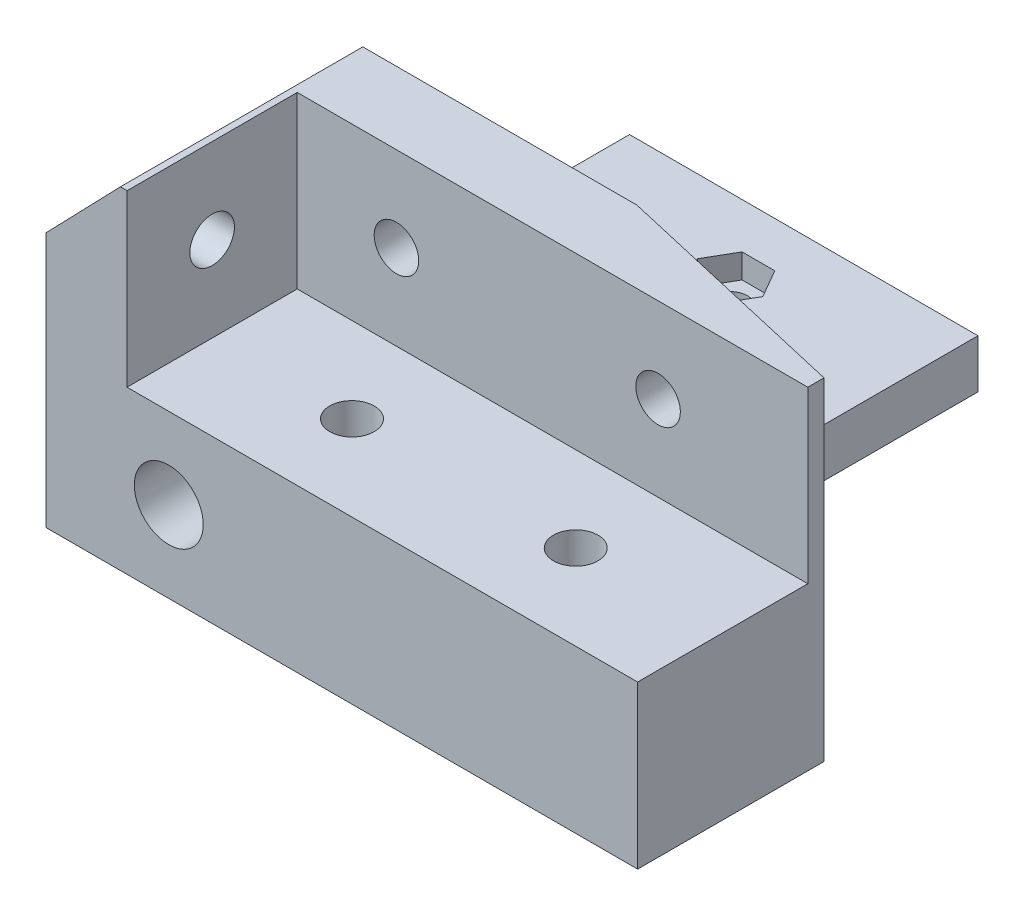
from build123d import *

# Parameters (mm, degrees)
SKETCH_1_R          = 2.15
EXTRUDE_1_DEPTH     = 6
EXTRUDE_2_DEPTH     = 35
SKETCH_3_W          = 63
SKETCH_3_H          = 21
CUT_EXTRUDE_1_DEPTH = 21
SKETCH_4_R          = 2.75
CUT_EXTRUDE_2_DEPTH = 87.609201921
CHAMFER_1_SIZE      = 9.5
CHAMFER_1_SIZE_2    = 9.174043361
CUT_EXTRUDE_START   = -10
SKETCH_5_R          = 4.25
CUT_EXTRUDE_3_DEPTH = 5
SKETCH_6_R          = 2.75
CUT_EXTRUDE_4_DEPTH = 78.360370477
CUT_EXTRUDE_START_2 = -4
SKETCH_7_R          = 4.25
CUT_EXTRUDE_5_DEPTH = 5
SKETCH_8_R          = 2.75
CUT_EXTRUDE_6_DEPTH = 64.20427816
SKETCH_10_R         = 4.25
CUT_EXTRUDE_7_DEPTH = 15.5
SKETCH_11_R         = 4.25
CUT_EXTRUDE_8_DEPTH = 20
CUT_EXTRUDE_9_DEPTH = 3


with BuildPart() as part:
    # Эскиз1 → Бобышка-Вытянуть1 (new body)
    with BuildSketch(Plane(origin=(0, 0, 0), x_dir=(1, 0, 0), z_dir=(0, 1, 0))):
        Polygon((-31.737099952, -43.025037564), (41.262900048, -43.025037564), (41.262900048, -20.025037564), (11.262900048, -13.109402144), (11.262900048, 28.974962436), (-31.737099952, 28.974962436), align=None)
        with Locations(Location((-10.237099952, 19.879797383, 0), (0, 0, 270))):
            Circle(SKETCH_1_R, mode=Mode.SUBTRACT)
        with Locations(Location((0, 0, 0), (0, 0, 270))):
            Circle(SKETCH_1_R, mode=Mode.SUBTRACT)
    extrude(amount=EXTRUDE_1_DEPTH)

    # Эскиз2 → Бобышка-Вытянуть2 (add)
    with BuildSketch(Plane(origin=(0, 6, 0), x_dir=(1, 0, 0), z_dir=(0, 1, 0))):
        Polygon((41.262900048, -20.025037564), (11.262900048, -13.109402144), (-31.737099952, -13.109402144), (-31.737099952, -43.025037564), (41.262900048, -43.025037564), align=None)
    extrude(amount=EXTRUDE_2_DEPTH)

    # Эскиз3 → Вырез-Вытянуть1 (cut)
    with BuildSketch(Plane(origin=(0, 41, 0), x_dir=(1, 0, 0), z_dir=(0, 1, 0))):
        with Locations((9.762900048, -32.525037564)):
            Rectangle(SKETCH_3_W, SKETCH_3_H)
    extrude(amount=-CUT_EXTRUDE_1_DEPTH, mode=Mode.SUBTRACT)

    # Эскиз4 → Вырез-Вытянуть2 (cut, through all)
    with BuildSketch(Plane(origin=(-21.737099952, 0, 0), x_dir=(0, 0, -1), z_dir=(1, 0, 0))):
        with Locations((-32.525037564, 30.5)):
            Circle(SKETCH_4_R)
    extrude(amount=-CUT_EXTRUDE_2_DEPTH, mode=Mode.SUBTRACT)

    # Фаска1
    # the kernel refuses this chamfer: 9.5, 9.174043361 mm, written as the material it takes off along each edge
    with BuildSketch(Plane(origin=(-31.737099952, 41, -11.332881065), x_dir=(-0.026999337430198715, -0.9996354514413394, 0), z_dir=(0, 0, 1))) as chamfer_1_piece_1:
        Polygon((CHAMFER_1_SIZE * 0.999635451441, CHAMFER_1_SIZE * 0.0269993374302), (-CHAMFER_1_SIZE_2 * 0.0269993374292, CHAMFER_1_SIZE_2 * 0.999635451405), (0, 0), align=None)
    extrude(amount=78.800201839, mode=Mode.SUBTRACT)

    # Эскиз5 → Вырез-Вытянуть3 (cut)
    with BuildSketch(Plane(origin=(-21.737099952, 0, 0), x_dir=(0, 0, -1), z_dir=(1, 0, 0)).offset(CUT_EXTRUDE_START)):
        with Locations(Location((-32.525037564, 30.5, 0), (0, 0, 166.391039369))):
            Circle(SKETCH_5_R)
    extrude(amount=CUT_EXTRUDE_3_DEPTH, mode=Mode.SUBTRACT)

    # Эскиз6 → Вырез-Вытянуть4 (cut, through all)
    with BuildSketch(Plane.XY.offset(22.025037564)):
        with Locations((-9.495708976, 30.5)):
            Circle(SKETCH_6_R)
        with Locations((22.785725254, 30.5)):
            Circle(SKETCH_6_R)
    extrude(amount=-CUT_EXTRUDE_4_DEPTH, mode=Mode.SUBTRACT)

    # Эскиз7 → Вырез-Вытянуть5 (cut)
    with BuildSketch(Plane.XY.offset(22.025037564).offset(CUT_EXTRUDE_START_2)):
        with Locations((-9.495708976, 30.5)):
            Circle(SKETCH_7_R)
        with Locations((22.785725254, 30.5)):
            Circle(SKETCH_7_R)
    extrude(amount=-CUT_EXTRUDE_5_DEPTH, mode=Mode.SUBTRACT)

    # Эскиз8 → Вырез-Вытянуть6 (cut, through all)
    with BuildSketch(Plane(origin=(0, 20, 0), x_dir=(1, 0, 0), z_dir=(0, 1, 0))):
        with Locations(Location((-4.483206982, -32.525037564, 0), (0, 0, 270))):
            Circle(SKETCH_8_R)
        with Locations(Location((23.126402015, -32.525037564, 0), (0, 0, 270))):
            Circle(SKETCH_8_R)
    extrude(amount=-CUT_EXTRUDE_6_DEPTH, mode=Mode.SUBTRACT)

    # Эскиз10 → Вырез-Вытянуть7 (cut)
    with BuildSketch(Plane.XZ):
        with Locations(Location((23.126402015, 32.525037564, 0), (0, 0, 270))):
            Circle(SKETCH_10_R)
        with Locations(Location((-4.483206982, 32.525037564, 0), (0, 0, 270))):
            Circle(SKETCH_10_R)
    extrude(amount=-CUT_EXTRUDE_7_DEPTH, mode=Mode.SUBTRACT)

    # Эскиз11 → Вырез-Вытянуть8 (cut)
    with BuildSketch(Plane.XY.offset(43.025037564)):
        with Locations((-16.587099952, 10)):
            Circle(SKETCH_11_R)
    extrude(amount=-CUT_EXTRUDE_8_DEPTH, mode=Mode.SUBTRACT)

    # Эскиз12 → Вырез-Вытянуть9 (cut)
    with BuildSketch(Plane(origin=(0, 6, 0), x_dir=(1, 0, 0), z_dir=(0, 1, 0))):
        Polygon((-6.195648068, 19.879797383), (-8.21637401, 23.379797383), (-12.257825894, 23.379797383), (-14.278551837, 19.879797383), (-12.257825894, 16.379797383), (-8.21637401, 16.379797383), align=None)
        Polygon((4.041451884, 0), (2.020725942, 3.5), (-2.020725942, 3.5), (-4.041451884, 0), (-2.020725942, -3.5), (2.020725942, -3.5), align=None)
    extrude(amount=-CUT_EXTRUDE_9_DEPTH, mode=Mode.SUBTRACT)


solid = part.part
